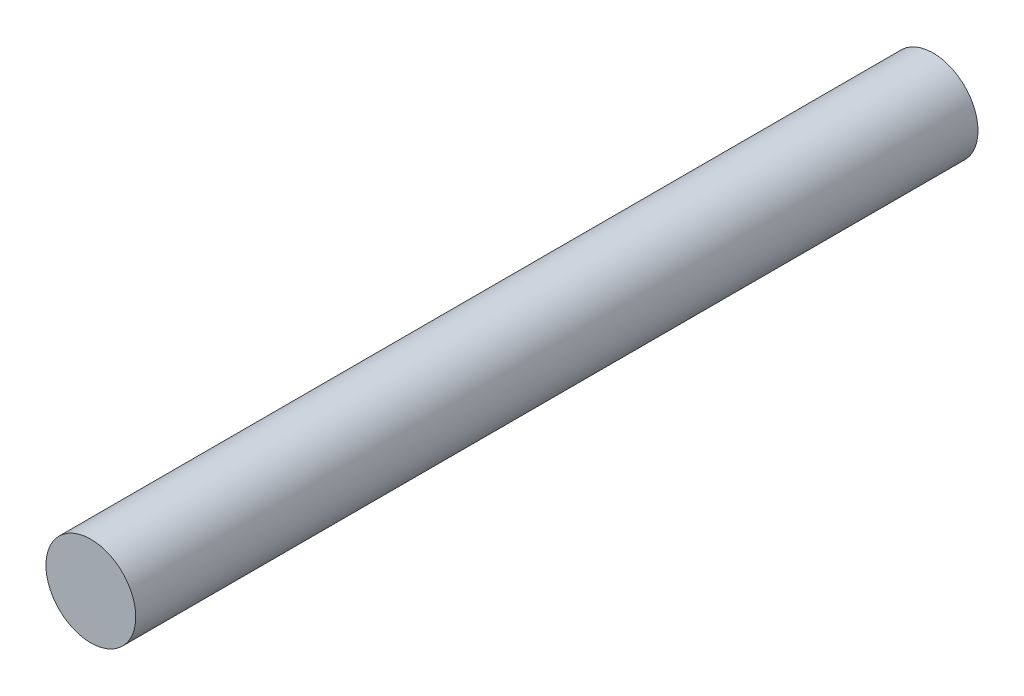
from build123d import *

# Parameters (mm, degrees)
SKETCH1_R           = 0.4
BOSS_EXTRUDE1_DEPTH = 7.5
SCALE1_SCALE        = 6


with BuildPart() as part:
    # Sketch1 → Boss-Extrude1 (new body)
    with BuildSketch(Plane.XY):
        Circle(SKETCH1_R)
    extrude(amount=BOSS_EXTRUDE1_DEPTH)


with BuildPart() as part_1:
    # Scale1: scaled about (0, 0, 3.75)
    add(part.part.scale(SCALE1_SCALE).moved(Location((0, 0, -18.75))))


solid = part_1.part
